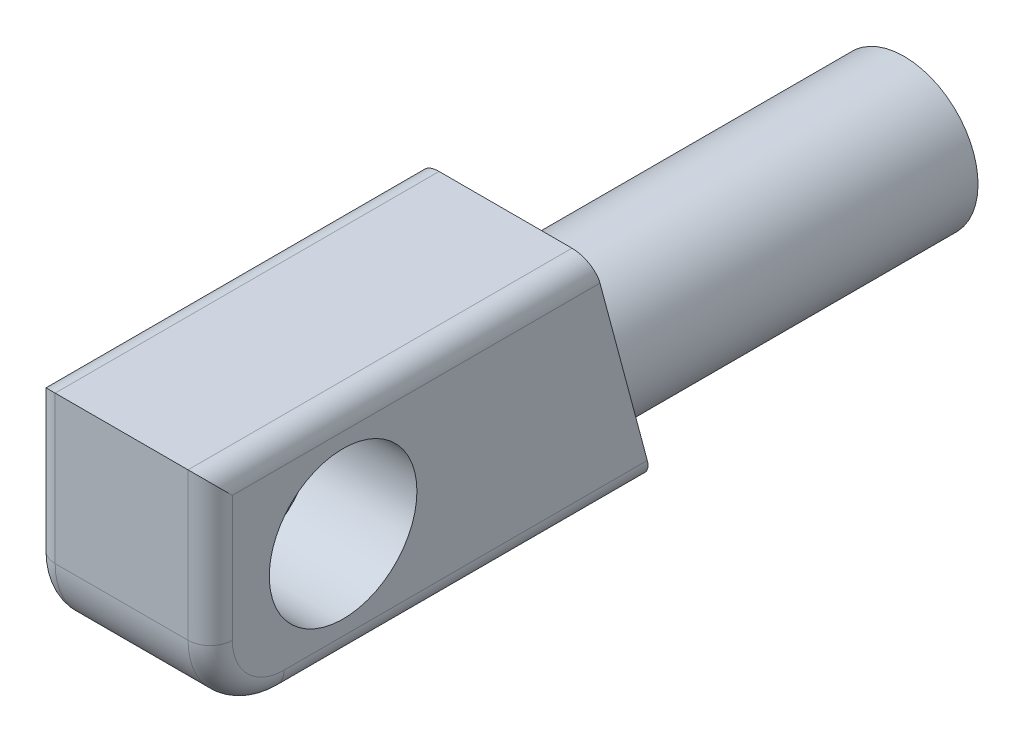
from build123d import *

# Parameters (mm, degrees)
BOSS_EXTRUDE1_DEPTH = 6
SKETCH2_R           = 4
BOSS_EXTRUDE2_DEPTH = 40
CUT_EXTRUDE1_START  = -1
SKETCH3_R           = 5
CUT_EXTRUDE1_DEPTH  = 43.136966344
FILLET1_R           = 5
FILLET2_R           = 1.5


with BuildPart() as part:
    # Sketch1 → Boss-Extrude1 (new, symmetric)
    with BuildSketch(Plane(origin=(0, 0, 0), x_dir=(0, 0, -1), z_dir=(1, 0, 0))):
        Polygon((13, 7.5), (17, -7.5), (-13, -7.5), (-13, 7.5), align=None)
    extrude(amount=BOSS_EXTRUDE1_DEPTH, both=True)

    # Sketch2 → Boss-Extrude2 (add)
    with BuildSketch(Plane.XY):
        with BuildLine():
            Line((-1, -6.898979486), (-1, -7.5))
            Line((-1, -7.5), (1, -7.5))
            Line((1, -7.5), (1, -6.898979486))
            ThreePointArc((1, -6.898979486), (0, 3), (-1, -6.898979486))
        make_face()
        with Locations((0, -2)):
            Circle(SKETCH2_R, mode=Mode.SUBTRACT)
    extrude(amount=-BOSS_EXTRUDE2_DEPTH)

    # Sketch3 → Cut-Extrude1 (cut, through all)
    with BuildSketch(Plane(origin=(0, 0, 0), x_dir=(0, 0, -1), z_dir=(1, 0, 0)).offset(CUT_EXTRUDE1_START)):
        with Locations((-4, 0)):
            Circle(SKETCH3_R)
    extrude(amount=CUT_EXTRUDE1_DEPTH, mode=Mode.SUBTRACT)

    # Fillet1
    fillet1_edges = [part.edges().sort_by_distance(p)[0] for p in [
        (0, -7.5, 13),
    ]]
    fillet(fillet1_edges, radius=FILLET1_R)

    # Fillet2
    fillet2_edges = [part.edges().sort_by_distance(p)[0] for p in [
        (6, 2.5, 13),
        (6, -6.035533906, 11.535533906),
        (-6, -7.5, -4.5),
        (-6, -6.035533906, 11.535533906),
        (6, -7.5, -4.5),
        (6, 7.5, 0),
        (-6, 7.5, 0),
        (-6, 2.5, 13),
    ]]
    fillet(fillet2_edges, radius=FILLET2_R)


solid = part.part
